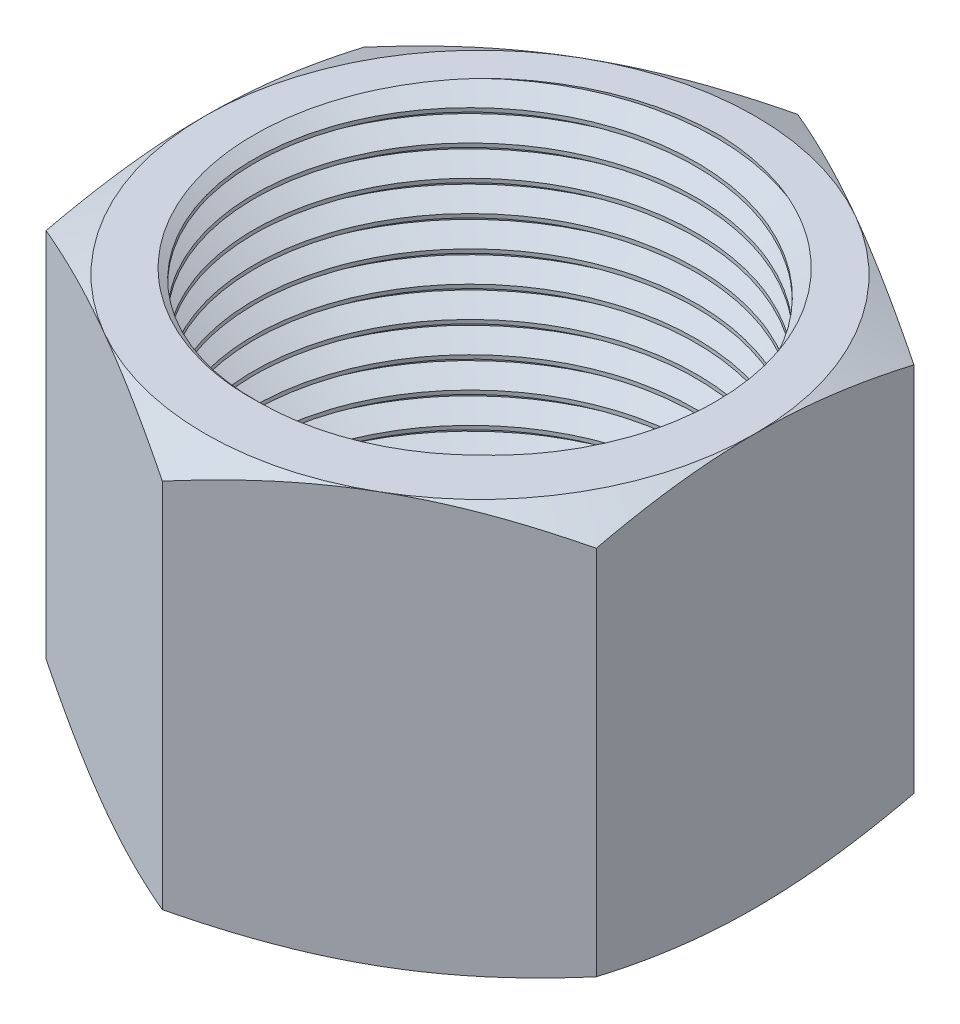
from build123d import *

# Parameters (mm, degrees)
EXTRUDE1_DEPTH   = 28.448
SKETCH2_W        = 16.66875
SKETCH2_H        = 28.448
CUT_SWEEP1_PITCH = 2.116666667
SKETCH7_W        = 16.66875
SKETCH7_H        = 4.741333333
SKETCH8_W        = 13.843
SKETCH8_H        = 4.741333333


with BuildPart() as part:
    # Sketch1 → Extrude1 (new body)
    with BuildSketch(Plane(origin=(0, 0, 0), x_dir=(1, 0, 0), z_dir=(0, 1, 0))):
        Polygon((0, 21.997045256), (-19.05, 10.998522628), (-19.05, -10.998522628), (0, -21.997045256), (19.05, -10.998522628), (19.05, 10.998522628), align=None)
    extrude(amount=EXTRUDE1_DEPTH)


with BuildPart() as body_2:
    # Sketch2 → Revolve1 (revolve)
    with BuildSketch(Plane(origin=(0, 0, 0), x_dir=(0, 0, -1), z_dir=(1, 0, 0))):
        with Locations((8.334375, 14.224)):
            Rectangle(SKETCH2_W, SKETCH2_H)
    revolve(axis=Axis((0, -16.66875, 0), (0, 1, 0)))

    # Cut-Sweep1: the profile of Sketch10 profile screwed along a right-hand helix of 13.44 turns, 10 arcs to a turn; built about Z, then put on its axis
    cut_sweep1_z = Axis((0, 0, 0), (0, 0, 1))
    cut_sweep1_corners = [(16.66935, 0, -1.852429743), (16.66935, 0, 0.00034641), (15.293934671, 0, -0.79375), (15.293934671, 0, -1.058333333)]
    with BuildLine(mode=Mode.PRIVATE) as cut_sweep1_profile:
        Line(cut_sweep1_corners[0], cut_sweep1_corners[1])
        Line(cut_sweep1_corners[1], cut_sweep1_corners[2])
        Line(cut_sweep1_corners[2], cut_sweep1_corners[3])
        Line(cut_sweep1_corners[3], cut_sweep1_corners[0])
    cut_sweep1_cap = Face(cut_sweep1_profile.wire())
    cut_sweep1_turn_angles = [0, 18, 36, 54, 72, 90, 108, 126, 144, 162, 180, 198, 216, 234, 252, 270, 288, 306, 324, 342, 360]
    cut_sweep1_turn_weights = [1, 0.9510565162951535, 1, 0.9510565162951535, 1, 0.9510565162951535, 1, 0.9510565162951535, 1, 0.9510565162951535, 1, 0.9510565162951535, 1, 0.9510565162951535, 1, 0.9510565162951535, 1, 0.9510565162951535, 1, 0.9510565162951535, 1]
    cut_sweep1_turn_rails = [Edge.make_bspline([Vector(p[0], p[1], 0).rotate(cut_sweep1_z, cut_sweep1_turn_angles[k]) / cut_sweep1_turn_weights[k] + Vector(0, 0, p[2] + CUT_SWEEP1_PITCH * cut_sweep1_turn_angles[k] / 360) for k in range(21)], [0, 0, 0, 1, 1, 2, 2, 3, 3, 4, 4, 5, 5, 6, 6, 7, 7, 8, 8, 9, 9, 10, 10, 10], 2, cut_sweep1_turn_weights) for p in cut_sweep1_corners]
    cut_sweep1_turn_sides = [Face.make_surface_from_curves(cut_sweep1_turn_rails[p[0]], cut_sweep1_turn_rails[p[1]]) for p in [(0, 1), (1, 2), (2, 3), (3, 0)]]
    cut_sweep1_last_angles = [4680, 4698, 4716, 4734, 4752, 4770, 4788, 4806, 4824, 4831.2, 4838.4]
    cut_sweep1_last_weights = [1, 0.9510565162951535, 1, 0.9510565162951535, 1, 0.9510565162951535, 1, 0.9510565162951535, 1, 0.9921147013144445, 1]
    cut_sweep1_last_rails = [Edge.make_bspline([Vector(p[0], p[1], 0).rotate(cut_sweep1_z, cut_sweep1_last_angles[k]) / cut_sweep1_last_weights[k] + Vector(0, 0, p[2] + CUT_SWEEP1_PITCH * cut_sweep1_last_angles[k] / 360) for k in range(11)], [0, 0, 0, 1, 1, 2, 2, 3, 3, 4, 4, 5, 5, 5], 2, cut_sweep1_last_weights) for p in cut_sweep1_corners]
    cut_sweep1_last_sides = [Face.make_surface_from_curves(cut_sweep1_last_rails[p[0]], cut_sweep1_last_rails[p[1]]) for p in [(0, 1), (1, 2), (2, 3), (3, 0)]]
    cut_sweep1 = Plane(origin=(0, 28.448, 0), x_dir=(0, 0, -1), z_dir=(0, -1, 0)) * Solid(Shell([*[p.moved(Location((0, 0, CUT_SWEEP1_PITCH * i))) for i in range(13) for p in cut_sweep1_turn_sides], *cut_sweep1_last_sides, cut_sweep1_cap, cut_sweep1_cap.rotate(cut_sweep1_z, 4838.4).moved(Location((0, 0, CUT_SWEEP1_PITCH * 4838.4 / 360)))]))
    add(cut_sweep1, mode=Mode.SUBTRACT)


with BuildPart() as part_1:
    add(part.part)

    # Combine1: cut body 2
    add(body_2.part, mode=Mode.SUBTRACT)

    # Sketch5 → Cut-Revolve3 (revolve, cut)
    with BuildSketch(Plane(origin=(0, 0, 0), x_dir=(0, 0, -1), z_dir=(1, 0, 0))):
        Polygon((0, 0), (19.05, 0), (21.997045256, 1.374229772), (21.997045256, 27.073770228), (19.05, 28.448), (0, 28.448), (0, 29.718), (23.267045256, 29.718), (23.267045256, -1.27), (0, -1.27), align=None)
    revolve(axis=Axis((0, 0, 0), (0, 1, 0)), mode=Mode.SUBTRACT)

    # Sketch7 → Revolve2 (revolve)
    with BuildSketch(Plane(origin=(0, 0, 0), x_dir=(0, 0, -1), z_dir=(1, 0, 0))):
        with Locations((8.334375, 2.370666667)):
            Rectangle(SKETCH7_W, SKETCH7_H)
    revolve(axis=Axis((0, 0, 0), (0, 1, 0)))

    # Sketch8 → Cut-Revolve4 (revolve, cut)
    with BuildSketch(Plane(origin=(0, 0, 0), x_dir=(0, 0, -1), z_dir=(1, 0, 0))):
        with Locations((6.9215, 2.370666667)):
            Rectangle(SKETCH8_W, SKETCH8_H)
    revolve(axis=Axis((0, 0, 0), (0, 1, 0)), mode=Mode.SUBTRACT)


solid = part_1.part
